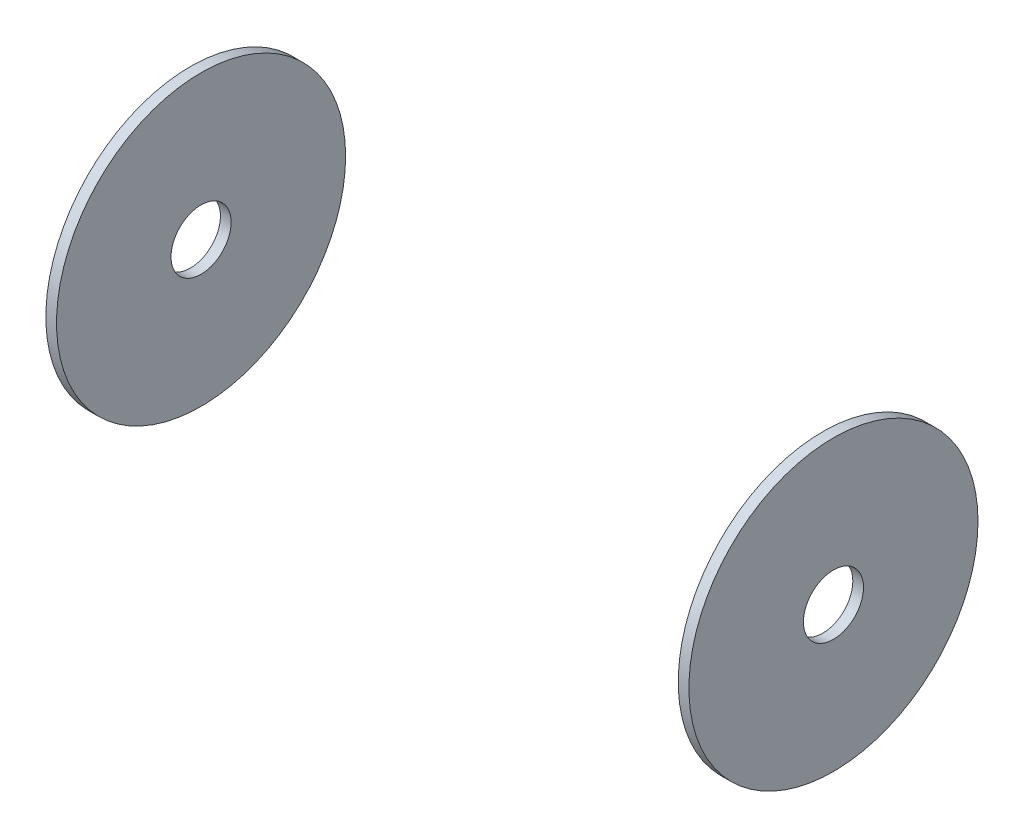
from build123d import *

# Parameters (mm, degrees)
SKETCH1_R           = 20.32
SKETCH1_R_2         = 4.22275
BOSS_EXTRUDE1_DEPTH = 1.500000048


with BuildPart() as part:
    # Sketch1 → Boss-Extrude1 (new body)
    with BuildSketch(Plane(origin=(43.699999952, 0, 0), x_dir=(0, 0, -1), z_dir=(1, 0, 0))):
        with Locations((-177.8, 26.67)):
            Circle(SKETCH1_R)
        with Locations((-177.8, 26.67)):
            Circle(SKETCH1_R_2, mode=Mode.SUBTRACT)
    extrude(amount=BOSS_EXTRUDE1_DEPTH)


with BuildPart() as body_2:
    # Mirror2: mirrored copy
    add(part.part.mirror(Plane(origin=(0, 0, 0), x_dir=(0, 0, 1), z_dir=(1, 0, 0))))


solid = Compound([part.part, body_2.part])
